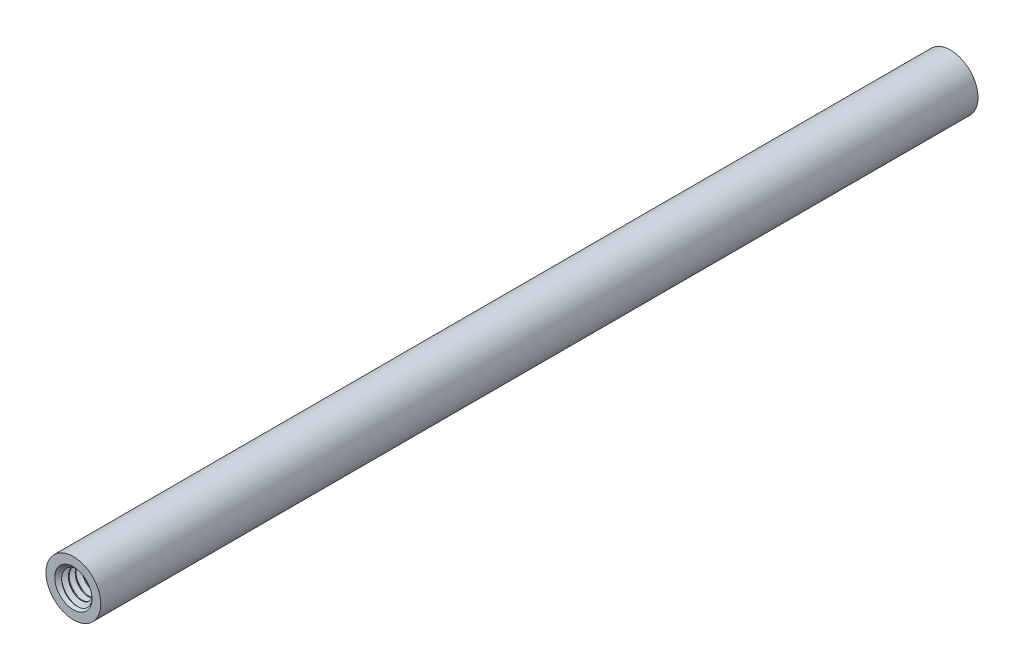
from build123d import *

# Parameters (mm, degrees)
BOSS_EXTRUDE1_START = 50.8
SKETCH13_R          = 2.0828
BOSS_EXTRUDE1_DEPTH = 11.1125
CUT_SWEEP1_PITCH    = 0.79375
CIRPATTERN1_COUNT   = 2
CIRPATTERN1_ANGLE   = 180
EXTRUDE1_DEPTH      = 50.8
EXTRUDE1_DEPTH_BACK = 50.8
SKETCH1_R           = 3.175


with BuildPart() as part:
    # Sketch13 → Boss-Extrude1 (new body)
    with BuildSketch(Plane.XY.offset(BOSS_EXTRUDE1_START)):
        Circle(SKETCH13_R)
    extrude(amount=-BOSS_EXTRUDE1_DEPTH)

    # Cut-Sweep1: the profile of Sketch15 profile screwed along a right-hand helix of 15 turns, 8 arcs to a turn; built about Z, then put on its axis
    cut_sweep1_z = Axis((0, 0, 0), (0, 0, 1))
    cut_sweep1_corners = [(2.0831, 0, -0.694704455), (2.0831, 0, 0.000173205), (1.567244252, 0, -0.29765625), (1.567244252, 0, -0.396875)]
    with BuildLine(mode=Mode.PRIVATE) as cut_sweep1_profile:
        Line(cut_sweep1_corners[0], cut_sweep1_corners[1])
        Line(cut_sweep1_corners[1], cut_sweep1_corners[2])
        Line(cut_sweep1_corners[2], cut_sweep1_corners[3])
        Line(cut_sweep1_corners[3], cut_sweep1_corners[0])
    cut_sweep1_cap = Face(cut_sweep1_profile.wire())
    cut_sweep1_turn_angles = [0, 22.5, 45, 67.5, 90, 112.5, 135, 157.5, 180, 202.5, 225, 247.5, 270, 292.5, 315, 337.5, 360]
    cut_sweep1_turn_weights = [1, 0.9238795325112867, 1, 0.9238795325112867, 1, 0.9238795325112867, 1, 0.9238795325112867, 1, 0.9238795325112867, 1, 0.9238795325112867, 1, 0.9238795325112867, 1, 0.9238795325112867, 1]
    cut_sweep1_turn_rails = [Edge.make_bspline([Vector(p[0], p[1], 0).rotate(cut_sweep1_z, cut_sweep1_turn_angles[k]) / cut_sweep1_turn_weights[k] + Vector(0, 0, p[2] + CUT_SWEEP1_PITCH * cut_sweep1_turn_angles[k] / 360) for k in range(17)], [0, 0, 0, 1, 1, 2, 2, 3, 3, 4, 4, 5, 5, 6, 6, 7, 7, 8, 8, 8], 2, cut_sweep1_turn_weights) for p in cut_sweep1_corners]
    cut_sweep1_turn_sides = [Face.make_surface_from_curves(cut_sweep1_turn_rails[p[0]], cut_sweep1_turn_rails[p[1]]) for p in [(0, 1), (1, 2), (2, 3), (3, 0)]]
    cut_sweep1 = Plane(origin=(0, 0, 50.8), x_dir=(0, 1, 0), z_dir=(0, 0, -1)) * Solid(Shell([*[p.moved(Location((0, 0, CUT_SWEEP1_PITCH * i))) for i in range(15) for p in cut_sweep1_turn_sides], cut_sweep1_cap, cut_sweep1_cap.rotate(cut_sweep1_z, 5400).moved(Location((0, 0, CUT_SWEEP1_PITCH * 5400 / 360)))]))
    add(cut_sweep1, mode=Mode.SUBTRACT)

    # Boss-Extrude2 cone 1 section (through the dimple's axis) → Boss-Extrude2 (revolve)
    with BuildSketch(Plane(origin=(0, 0, 50.8), x_dir=(0, -1, 0), z_dir=(1, 0, 0))):
        Polygon((0, 0), (2.159, 0), (0, 2.159), align=None)
    revolve(axis=Axis((0, 0, 50.8), (0, 0, -1)))


with BuildPart() as cirpattern1_1:
    # CirPattern1: pattern copy
    add(part.part.rotate(Axis((0, 3.175, 0), (0, -1, 0)), 1 * CIRPATTERN1_ANGLE / (CIRPATTERN1_COUNT - 1)))


with BuildPart() as body_3:
    # Sketch1 → Extrude1 (new, two sides: drawn at the far end of the back side and taken through both)
    with BuildSketch(Plane.XY.offset(-EXTRUDE1_DEPTH_BACK)):
        Circle(SKETCH1_R)
    extrude(amount=EXTRUDE1_DEPTH + EXTRUDE1_DEPTH_BACK)

    # Combine1: cut CirPattern1_1, part
    add(cirpattern1_1.part, mode=Mode.SUBTRACT)
    add(part.part, mode=Mode.SUBTRACT)


solid = body_3.part
